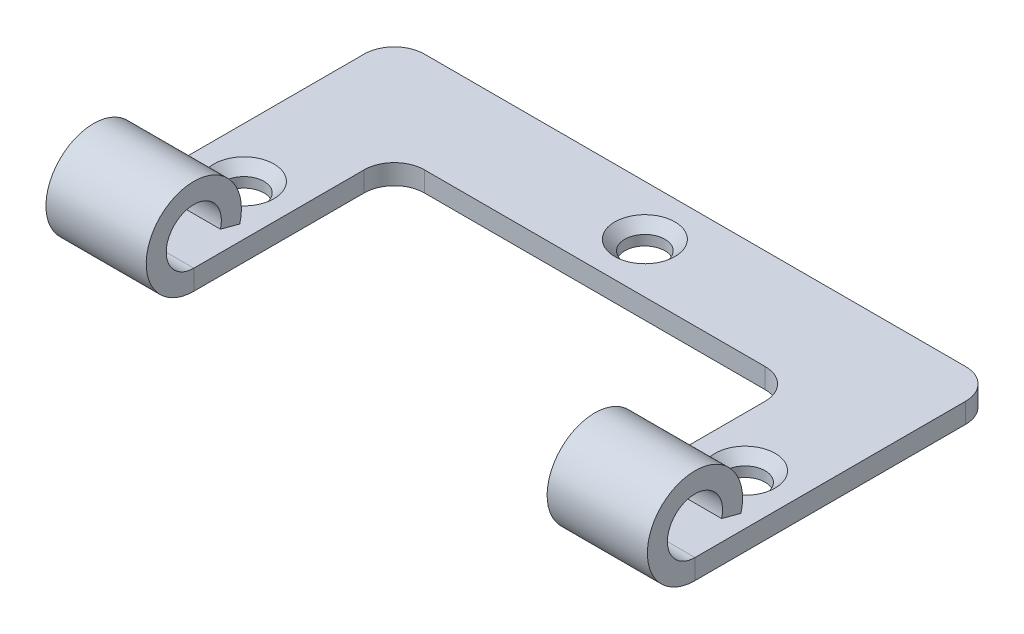
from build123d import *

# Parameters (mm, degrees)
BASE_FLANGE1_DEPTH = 2
HEM1_START         = -30
HEM1_DEPTH         = 10
HEM1_START_2       = 20
HEM1_2_DEPTH       = 10
SKETCH14_R         = 2
CUT_EXTRUDE1_DEPTH = 10
CHAMFER1_SIZE      = 1


# Read off the part's stored shape, not the designer's step: Hem1
# Sheet-metal steps are written as plain solids
with BuildPart() as part:
    # Sketch1 → Base-Flange1 (new body)
    with BuildSketch(Plane(origin=(0, 0, 0), x_dir=(1, 0, 0), z_dir=(0, 1, 0))):
        with BuildLine():
            Line((20, -15), (30, -15))
            Line((30, -15), (30, 12))
            ThreePointArc((30, 12), (29.121320344, 14.121320344), (27, 15))
            Line((27, 15), (-27, 15))
            ThreePointArc((-27, 15), (-29.121320344, 14.121320344), (-30, 12))
            Line((-30, 12), (-30, -15))
            Line((-30, -15), (-20, -15))
            Line((-20, -15), (-20, 2))
            ThreePointArc((-20, 2), (-19.121320344, 4.121320344), (-17, 5))
            Line((-17, 5), (17, 5))
            ThreePointArc((17, 5), (19.121320344, 4.121320344), (20, 2))
            Line((20, 2), (20, -15))
        make_face()
    extrude(amount=-BASE_FLANGE1_DEPTH)

    # Hem1 outline → Hem1 (add)
    with BuildSketch(Plane.YZ.offset(HEM1_START)):
        with BuildLine():
            Line((2.038247626, 12.343703978), (1.520609536, 10.411852325))
            ThreePointArc((1.520609536, 10.411852325), (6.518428366, 17.891616788), (-2, 15))
            Line((-2, 15), (0, 15))
            ThreePointArc((0, 15), (4.931721686, 16.67409393), (2.038247626, 12.343703978))
        make_face()
    extrude(amount=HEM1_DEPTH)

    # Hem1 2 outline → Hem1 2 (add)
    with BuildSketch(Plane.YZ.offset(HEM1_START_2)):
        with BuildLine():
            Line((2.038247626, 12.343703978), (1.520609536, 10.411852325))
            ThreePointArc((1.520609536, 10.411852325), (6.518428366, 17.891616788), (-2, 15))
            Line((-2, 15), (0, 15))
            ThreePointArc((0, 15), (4.931721686, 16.67409393), (2.038247626, 12.343703978))
        make_face()
    extrude(amount=HEM1_2_DEPTH)

    # Sketch14 → Cut-Extrude1 (cut)
    with BuildSketch(Plane(origin=(0, 0, 0), x_dir=(1, 0, 0), z_dir=(0, 1, 0))):
        with Locations(Location((0, 10, 0), (0, 0, 270))):
            Circle(SKETCH14_R)
        with Locations(Location((-25, -5, 0), (0, 0, 270))):
            Circle(SKETCH14_R)
        with Locations(Location((25, -5, 0), (0, 0, 270))):
            Circle(SKETCH14_R)
    extrude(amount=-CUT_EXTRUDE1_DEPTH, mode=Mode.SUBTRACT)

    # Chamfer1
    chamfer1_edges = [part.edges().sort_by_distance(p)[0] for p in [
        (0, 0, -12),
        (-25, 0, 3),
        (25, 0, 3),
    ]]
    chamfer(chamfer1_edges, length=CHAMFER1_SIZE)


solid = part.part
